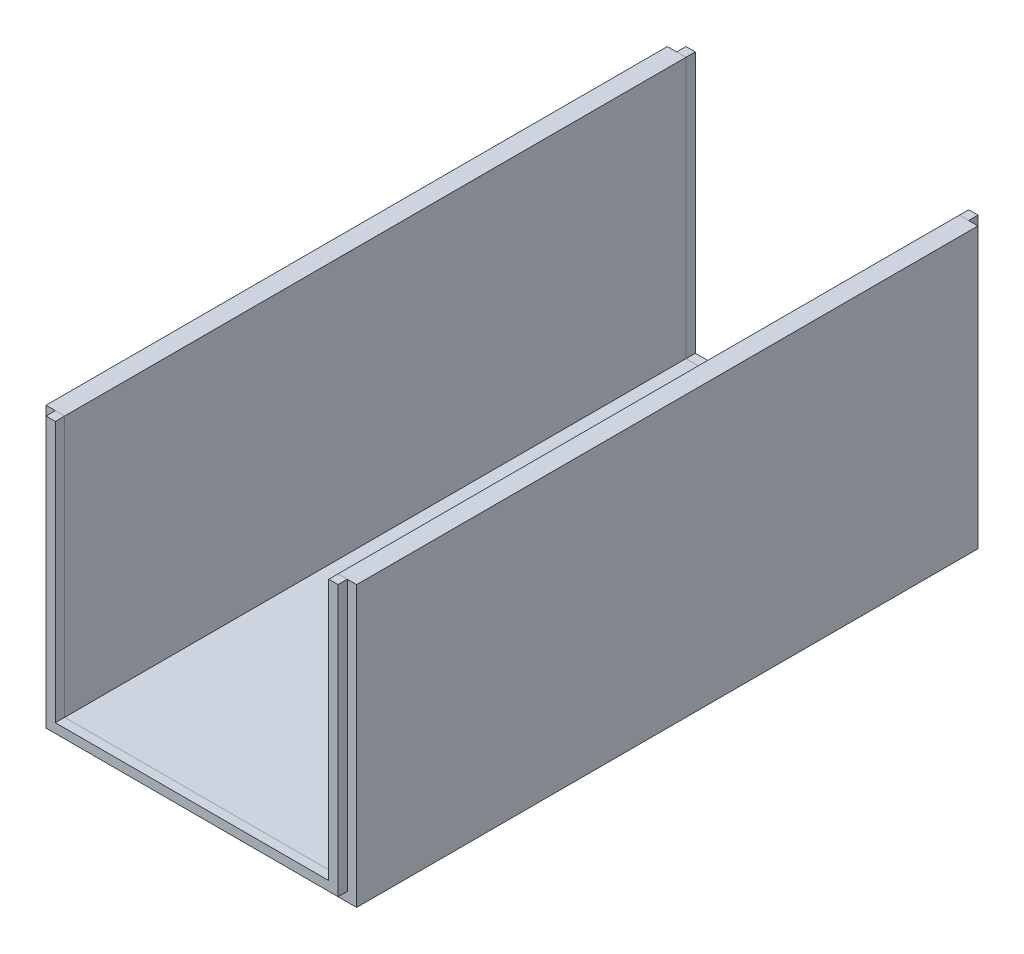
from build123d import *

# Parameters (mm, degrees)
SALIENTE_EXTRUIR1_DEPTH = 3
SALIENTE_EXTRUIR2_DEPTH = 100
SIMETR_A2_START         = -3
SIMETR_A2_OUTLINE_W     = 6
SIMETR_A2_OUTLINE_H     = 100
SIMETR_A2_DEPTH         = 90
SIMETR_A2_2_OUTLINE_W   = 88
SIMETR_A2_2_OUTLINE_H   = 100
SIMETR_A2_2_DEPTH       = 6
CROQUIS3_W              = 12.5
CROQUIS3_H              = 23
CORTAR_EXTRUIR1_DEPTH   = 6


# Read off the part's stored shape, not the designer's step: Simetría2
with BuildPart() as part:
    # Croquis1 → Saliente-Extruir1 (new body)
    with BuildSketch(Plane.XY):
        Polygon((-47, 0), (47, 0), (47, 87), (44, 87), (44, 3), (-44, 3), (-44, 87), (-47, 87), align=None)
    extrude(amount=SALIENTE_EXTRUIR1_DEPTH)


with BuildPart() as body_2:
    # Croquis2 → Saliente-Extruir2 (new body)
    with BuildSketch(Plane.XY.offset(3)):
        Polygon((-44, 87), (-44, 3), (44, 3), (44, 87), (50, 87), (50, -3), (-50, -3), (-50, 87), align=None)
    extrude(amount=SALIENTE_EXTRUIR2_DEPTH)

    # Simetría2 outline → Simetría2 (add)
    with BuildSketch(Plane(origin=(0, 0, 0), x_dir=(1, 0, 0), z_dir=(0, 1, 0)).offset(SIMETR_A2_START)):
        with Locations((-47, -153)):
            Rectangle(SIMETR_A2_OUTLINE_W, SIMETR_A2_OUTLINE_H)
        with Locations((47, -153)):
            Rectangle(SIMETR_A2_OUTLINE_W, SIMETR_A2_OUTLINE_H)
    extrude(amount=SIMETR_A2_DEPTH)

    # Simetr_a2 2 outline → Simetr_a2 2 (add)
    with BuildSketch(Plane(origin=(0, 0, 0), x_dir=(1, 0, 0), z_dir=(0, 1, 0)).offset(SIMETR_A2_START)):
        with Locations((0, -153)):
            Rectangle(SIMETR_A2_2_OUTLINE_W, SIMETR_A2_2_OUTLINE_H)
    extrude(amount=SIMETR_A2_2_DEPTH)

    # Croquis3 → Cortar-Extruir1 (cut)
    with BuildSketch(Plane(origin=(0, 3, 0), x_dir=(1, 0, 0), z_dir=(0, 1, 0))):
        with Locations((0, -103)):
            Rectangle(CROQUIS3_W, CROQUIS3_H)
    extrude(amount=-CORTAR_EXTRUIR1_DEPTH, mode=Mode.SUBTRACT)


with BuildPart() as body_3:
    # Simetría3: mirrored copy
    add(part.part.mirror(Plane.XY.offset(103)))


solid = Compound([part.part, body_2.part, body_3.part])
